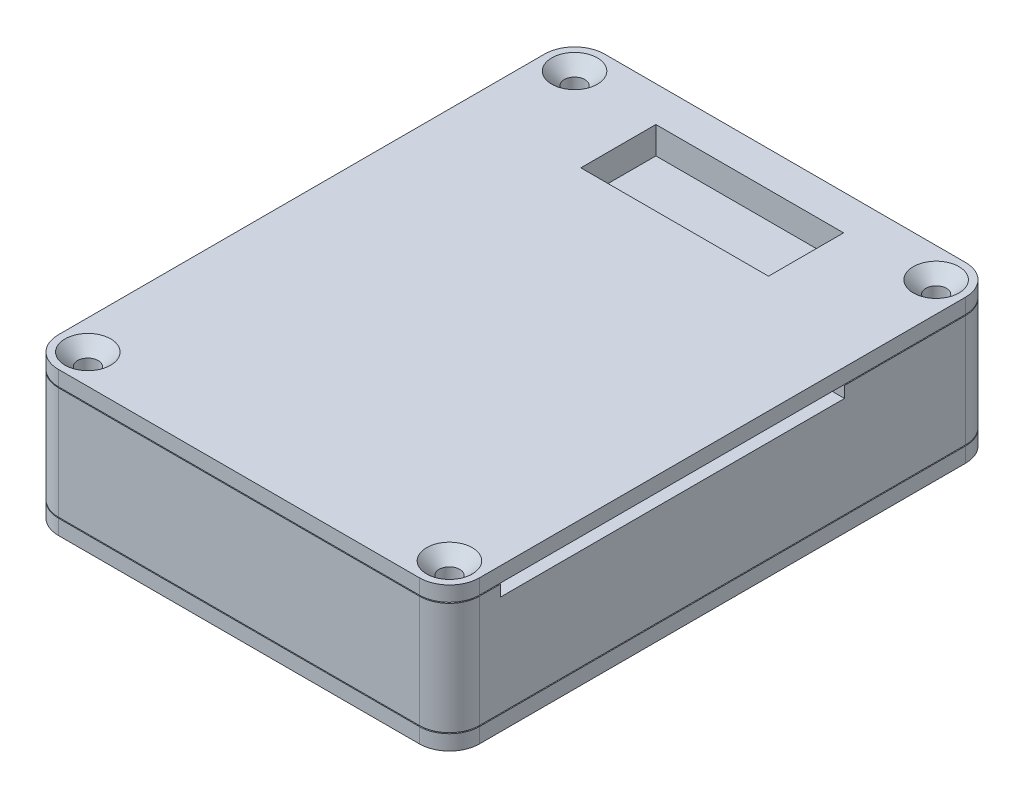
from build123d import *

# Parameters (mm, degrees)
MATERIAL_BOHRUNGEN_SIZE        = 8
SKETCH7_W                      = 60
SKETCH7_H                      = 80
TOP_DEPTH                      = 4.35
SKETCH9_W                      = 60
SKETCH9_H                      = 80
BOT_DEPTH                      = 4.35
RADIUS_AUSSENKANTEN_DEPTH      = 57.301820574
RADIUS_AUSSENKANTEN_DEPTH_BACK = 57.301820574
SKETCH8_OUTSIDE_W              = 91.82
SKETCH8_OUTSIDE_H              = 111.82
BOHRUNGEN_START                = -5.45
BOHRUNGEN_4MM_OUTLINE_R        = 2.1
BOHRUNGEN_4MM_DEPTH            = 10.9
BOHRUNGEN_3MM_DEPTH            = 57.301820574
BOHRUNGEN_3MM_DEPTH_BACK       = 57.301820574
SKETCH10_R                     = 1.65
BOHRUNGEN_FASE_1_SIZE          = 2
BOHRUNGEN_FASE_2_SIZE          = 2
KARTENSCHLITZ_DEPTH            = 57.301820574
KARTENSCHLITZ_DEPTH_BACK       = 30
SKETCH12_W                     = 55
SKETCH12_H                     = 1.5
CUT_EXTRUDE5_START             = 31.65
SKETCH13_W                     = 55
SKETCH13_H                     = 0.3
CUT_EXTRUDE5_DEPTH             = 2
BOSS_EXTRUDE3_DEPTH            = 41.5
BOSS_EXTRUDE3_DEPTH_BACK       = 41.5
SKETCH14_W                     = 63
SKETCH14_H                     = 1.6
BOSS_EXTRUDE3_2_DEPTH          = 41.5
BOSS_EXTRUDE3_2_DEPTH_BACK     = 41.5
SKETCH15_W                     = 30
SKETCH15_H                     = 12
CUT_EXTRUDE6_DEPTH             = 4.35


# Read off the part's stored shape, not the designer's step: Bohrungen 4mm
with BuildPart() as part:
    # Mid: sweep along a path in Path
    with BuildLine(Plane(origin=(0, 0, 0), x_dir=(1, 0, 0), z_dir=(0, 1, 0))) as mid_path:
        Line((30, -40), (-30, -40))
        Line((-30, -40), (-30, 40))
        Line((-30, 40), (30, 40))
        Line((30, 40), (30, -40))
    # Profile → Mid (sweep)
    with BuildSketch(Plane.XY):
        Polygon((-33.65, -8.95), (-31.65, -8.95), (-31.65, -5.45), (-30, -5.45), (-30, 5.45), (-31.65, 5.45), (-31.65, 8.95), (-33.65, 8.95), align=None)
        Polygon((-30, 7.15), (-31.5, 7.15), (-31.5, 9.1), (-33.65, 9.1), (-33.65, 11.5), (-30, 11.5), align=None)
        Polygon((-33.65, -11.5), (-30, -11.5), (-30, -7.15), (-31.5, -7.15), (-31.5, -9.1), (-33.65, -9.1), align=None)
    sweep(path=mid_path.line, transition=Transition.RIGHT)

    # Material Bohrungen
    material_bohrungen_edges = [part.edges().sort_by_distance(p)[0] for p in [
        (30, 0, 40),
        (-30, 0, 40),
        (30, 0, -40),
        (-30, 0, -40),
    ]]
    chamfer(material_bohrungen_edges, length=MATERIAL_BOHRUNGEN_SIZE)

    # Sketch7 → Top (add)
    with BuildSketch(Plane(origin=(0, 11.5, 0), x_dir=(1, 0, 0), z_dir=(0, 1, 0))):
        Rectangle(SKETCH7_W, SKETCH7_H)
    extrude(amount=-TOP_DEPTH)

    # Sketch9 → Bot (add)
    with BuildSketch(Plane.XZ.offset(11.5)):
        Rectangle(SKETCH9_W, SKETCH9_H)
    extrude(amount=-BOT_DEPTH)

    # Sketch8 outside → Radius Aussenkanten (cut, two sides: drawn at the far end of the back side and taken through both)
    with BuildSketch(Plane(origin=(0, 0, 0), x_dir=(1, 0, 0), z_dir=(0, 1, 0)).offset(-RADIUS_AUSSENKANTEN_DEPTH_BACK)):
        Rectangle(SKETCH8_OUTSIDE_W, SKETCH8_OUTSIDE_H)
        with BuildLine():
            Line((-28.85, 43.65), (28.85, 43.65))
            ThreePointArc((28.85, 43.65), (32.24411255, 42.24411255), (33.65, 38.85))
            Line((33.65, 38.85), (33.65, -38.85))
            ThreePointArc((33.65, -38.85), (32.24411255, -42.24411255), (28.85, -43.65))
            Line((28.85, -43.65), (-28.85, -43.65))
            ThreePointArc((-28.85, -43.65), (-32.24411255, -42.24411255), (-33.65, -38.85))
            Line((-33.65, -38.85), (-33.65, 38.85))
            ThreePointArc((-33.65, 38.85), (-32.24411255, 42.24411255), (-28.85, 43.65))
        make_face(mode=Mode.SUBTRACT)
    extrude(amount=RADIUS_AUSSENKANTEN_DEPTH + RADIUS_AUSSENKANTEN_DEPTH_BACK, mode=Mode.SUBTRACT)

    # Bohrungen 4mm outline → Bohrungen 4mm (cut)
    with BuildSketch(Plane(origin=(0, 0, 0), x_dir=(1, 0, 0), z_dir=(0, 1, 0)).offset(BOHRUNGEN_START)):
        with Locations((-28.9, 38.9)):
            Circle(BOHRUNGEN_4MM_OUTLINE_R)
        with Locations((28.9, 38.9)):
            Circle(BOHRUNGEN_4MM_OUTLINE_R)
        with Locations((28.9, -38.9)):
            Circle(BOHRUNGEN_4MM_OUTLINE_R)
        with Locations((-28.9, -38.9)):
            Circle(BOHRUNGEN_4MM_OUTLINE_R)
    extrude(amount=BOHRUNGEN_4MM_DEPTH, mode=Mode.SUBTRACT)

    # Sketch10 → Bohrungen 3mm (cut, two sides: drawn at the far end of the back side and taken through both)
    with BuildSketch(Plane(origin=(0, 0, 0), x_dir=(1, 0, 0), z_dir=(0, 1, 0)).offset(-BOHRUNGEN_3MM_DEPTH_BACK)):
        with Locations(Location((-28.9, 38.9, 0), (0, 0, 135))):
            Circle(SKETCH10_R)
        with Locations(Location((28.9, 38.9, 0), (0, 0, 45))):
            Circle(SKETCH10_R)
        with Locations(Location((28.9, -38.9, 0), (0, 0, 315))):
            Circle(SKETCH10_R)
        with Locations(Location((-28.9, -38.9, 0), (0, 0, 225))):
            Circle(SKETCH10_R)
    extrude(amount=BOHRUNGEN_3MM_DEPTH + BOHRUNGEN_3MM_DEPTH_BACK, mode=Mode.SUBTRACT)

    # Bohrungen Fase 1
    bohrungen_fase_1_edges = [part.edges().sort_by_distance(p)[0] for p in [
        (-27.733273811, 11.5, -37.733273811),
        (27.733273811, 11.5, -37.733273811),
        (27.733273811, 11.5, 37.733273811),
        (-27.733273811, 11.5, 37.733273811),
    ]]
    chamfer(bohrungen_fase_1_edges, length=BOHRUNGEN_FASE_1_SIZE)

    # Bohrungen Fase 2
    bohrungen_fase_2_edges = [part.edges().sort_by_distance(p)[0] for p in [
        (-27.733273811, -11.5, -37.733273811),
        (27.733273811, -11.5, -37.733273811),
        (27.733273811, -11.5, 37.733273811),
        (-27.733273811, -11.5, 37.733273811),
    ]]
    chamfer(bohrungen_fase_2_edges, length=BOHRUNGEN_FASE_2_SIZE)

    # Sketch12 → Kartenschlitz (cut, two sides: drawn at the far end of the back side and taken through both)
    with BuildSketch(Plane(origin=(0, 0, 0), x_dir=(0, 0, -1), z_dir=(1, 0, 0)).offset(-KARTENSCHLITZ_DEPTH_BACK)):
        with Locations((-8, 7.9)):
            Rectangle(SKETCH12_W, SKETCH12_H)
    extrude(amount=KARTENSCHLITZ_DEPTH + KARTENSCHLITZ_DEPTH_BACK, mode=Mode.SUBTRACT)

    # Sketch13 → Cut-Extrude5 (cut)
    with BuildSketch(Plane(origin=(0, 0, 0), x_dir=(0, 0, -1), z_dir=(1, 0, 0)).offset(CUT_EXTRUDE5_START)):
        with Locations((-8, 8.8)):
            Rectangle(SKETCH13_W, SKETCH13_H)
    extrude(amount=CUT_EXTRUDE5_DEPTH, mode=Mode.SUBTRACT)

    # Sketch15 → Cut-Extrude6 (cut)
    with BuildSketch(Plane(origin=(0, 11.5, 0), x_dir=(1, 0, 0), z_dir=(0, 1, 0))):
        with Locations((0, 32)):
            Rectangle(SKETCH15_W, SKETCH15_H)
    extrude(amount=-CUT_EXTRUDE6_DEPTH, mode=Mode.SUBTRACT)


with BuildPart() as body_2:
    # Sketch14 → Boss-Extrude3 (new, two sides: drawn at the far end of the back side and taken through both)
    with BuildSketch(Plane.XY.offset(-BOSS_EXTRUDE3_DEPTH_BACK)):
        with Locations((0, -6.3)):
            Rectangle(SKETCH14_W, SKETCH14_H)
    extrude(amount=BOSS_EXTRUDE3_DEPTH + BOSS_EXTRUDE3_DEPTH_BACK)


with BuildPart() as body_3:
    # Sketch14 → Boss-Extrude3 2 (new, two sides: drawn at the far end of the back side and taken through both)
    with BuildSketch(Plane.XY.offset(-BOSS_EXTRUDE3_2_DEPTH_BACK)):
        with Locations((0, 6.3)):
            Rectangle(SKETCH14_W, SKETCH14_H)
    extrude(amount=BOSS_EXTRUDE3_2_DEPTH + BOSS_EXTRUDE3_2_DEPTH_BACK)


solid = Compound([part.part, body_2.part, body_3.part])
